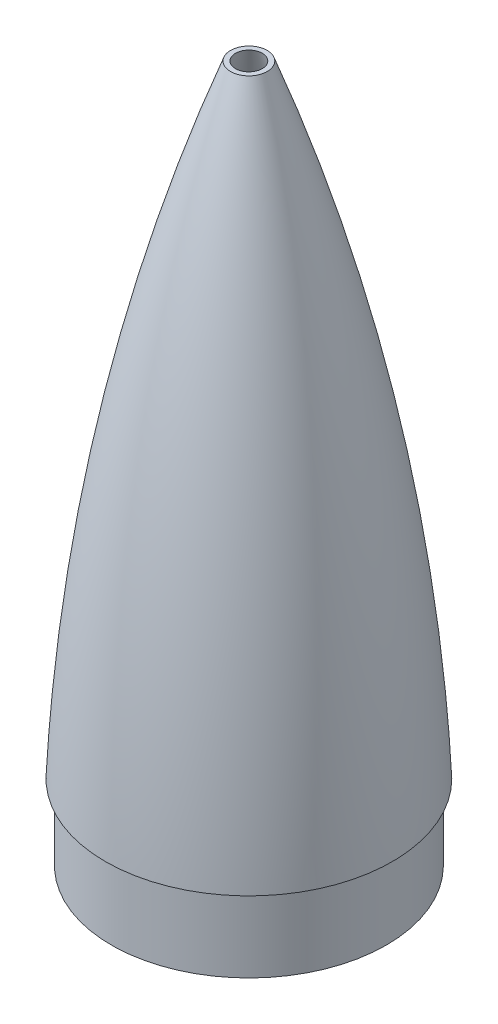
from build123d import *

# Parameters (mm, degrees)
SKETCH7_R           = 317.5
CUT_EXTRUDE2_DEPTH  = 50.8
SKETCH8_R           = 73.025
SKETCH8_R_2         = 69.85
BOSS_EXTRUDE1_DEPTH = 40


with BuildPart() as part:
    # Sketch2 → Revolve1 (revolve)
    with BuildSketch(Plane.XY):
        with BuildLine():
            Line((-76.2, 0), (-69.85, 0))
            ThreePointArc((-69.85, 0), (-47.974756047, 177.860494864), (0, 350.52))
            Line((0, 350.52), (0, 355.6))
            ThreePointArc((0, 355.6), (-52.988589627, 180.990412063), (-76.2, 0))
        make_face()
    revolve(axis=Axis((0, 355.6, 0), (0, -1, 0)))

    # Sketch7 → Cut-Extrude2 (cut)
    with BuildSketch(Plane(origin=(0, 381, 0), x_dir=(1, 0, 0), z_dir=(0, 1, 0))):
        Circle(SKETCH7_R)
    extrude(amount=-CUT_EXTRUDE2_DEPTH, mode=Mode.SUBTRACT)

    # Sketch8 → Boss-Extrude1 (add)
    with BuildSketch(Plane.XZ):
        Circle(SKETCH8_R)
        Circle(SKETCH8_R_2, mode=Mode.SUBTRACT)
    extrude(amount=BOSS_EXTRUDE1_DEPTH)


solid = part.part
